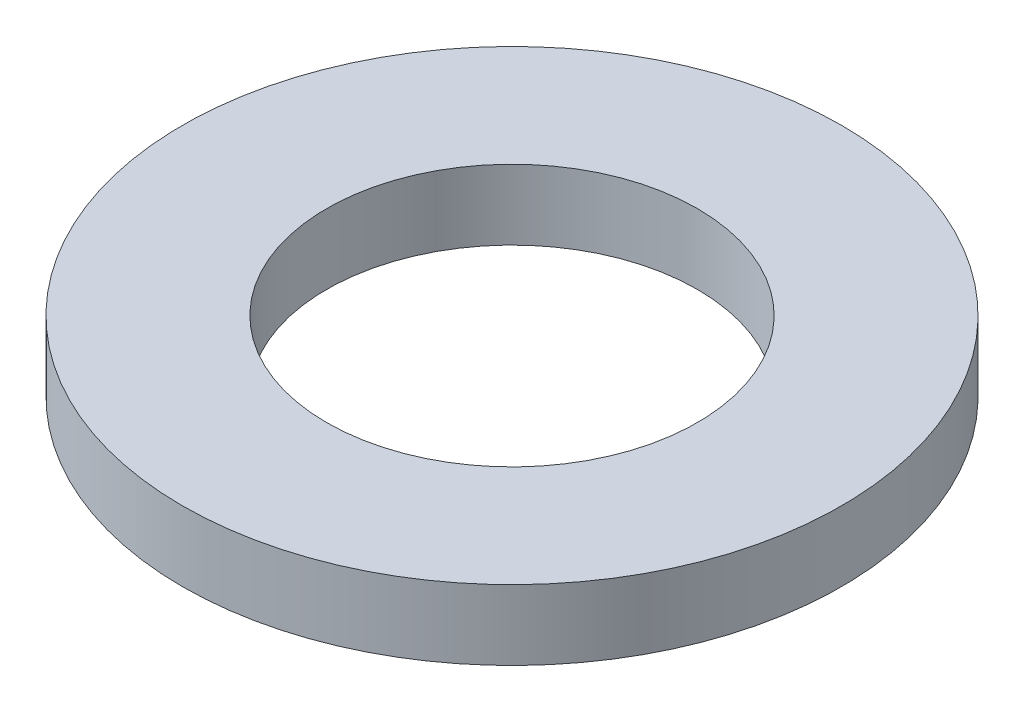
from build123d import *

# Parameters (mm, degrees)
SKETCH1_R           = 80
BOSS_EXTRUDE1_DEPTH = 17
SKETCH2_R           = 45
CUT_EXTRUDE1_DEPTH  = 115.407167608


with BuildPart() as part:
    # Sketch1 → Boss-Extrude1 (new body)
    with BuildSketch(Plane(origin=(0, 0, 0), x_dir=(1, 0, 0), z_dir=(0, 1, 0))):
        Circle(SKETCH1_R)
    extrude(amount=BOSS_EXTRUDE1_DEPTH)

    # Sketch2 → Cut-Extrude1 (cut, through all)
    with BuildSketch(Plane(origin=(0, 0, 0), x_dir=(1, 0, 0), z_dir=(0, 1, 0))):
        Circle(SKETCH2_R)
    extrude(amount=CUT_EXTRUDE1_DEPTH, mode=Mode.SUBTRACT)


solid = part.part
